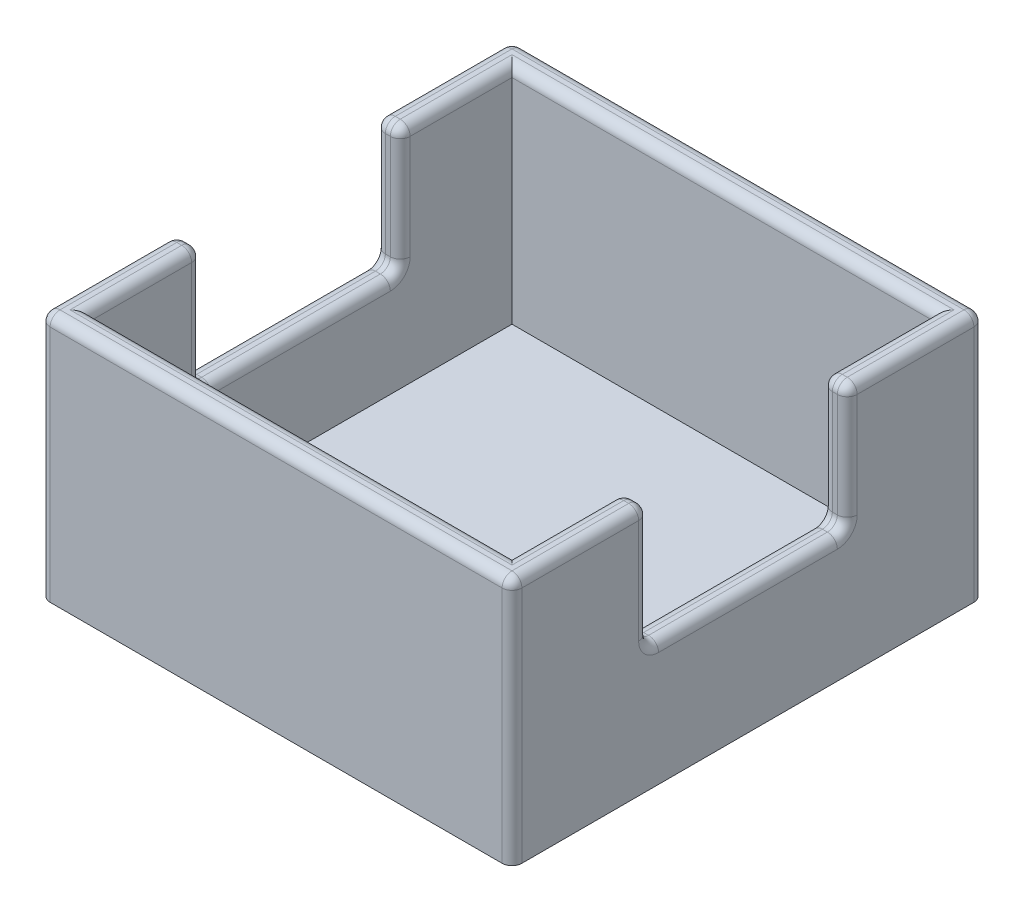
from build123d import *

# Parameters (mm, degrees)
SKETCH5_W           = 95
SKETCH5_H           = 95
BOSS_EXTRUDE3_DEPTH = 50
SHELL1_T            = -5
SKETCH6_W           = 40
SKETCH6_H           = 50
CUT_EXTRUDE2_DEPTH  = 100
FILLET2_R           = 2


with BuildPart() as part:
    # Sketch5 → Boss-Extrude3 (new body)
    with BuildSketch(Plane(origin=(0, 0, 0), x_dir=(1, 0, 0), z_dir=(0, 1, 0))):
        Rectangle(SKETCH5_W, SKETCH5_H)
    extrude(amount=BOSS_EXTRUDE3_DEPTH)

    # Shell1
    shell1_openings = [part.faces().sort_by_distance(p)[0] for p in [
        (0, 50, 0),
    ]]
    offset(amount=SHELL1_T, openings=shell1_openings, kind=Kind.INTERSECTION)

    # Sketch6 → Cut-Extrude2 (cut)
    with BuildSketch(Plane(origin=(47.5, 0, 0), x_dir=(0, 0, -1), z_dir=(1, 0, 0))):
        with Locations((0, 50)):
            Rectangle(SKETCH6_W, SKETCH6_H)
    extrude(amount=-CUT_EXTRUDE2_DEPTH, mode=Mode.SUBTRACT)

    # Fillet2
    fillet2_edges = [part.edges().sort_by_distance(p)[0] for p in [
        (42.5, 37.5, -20),
        (47.5, 37.5, -20),
        (47.5, 37.5, 20),
        (42.5, 37.5, 20),
        (-47.5, 37.5, 20),
        (-47.5, 37.5, -20),
        (-42.5, 37.5, -20),
        (-42.5, 37.5, 20),
        (45, 25, -20),
        (47.5, 25, 0),
        (45, 25, 20),
        (42.5, 25, 0),
        (-47.5, 25, 0),
        (-45, 25, -20),
        (-42.5, 25, 0),
        (-45, 25, 20),
        (0, 50, 47.5),
        (-47.5, 50, 33.75),
        (-45, 50, 20),
        (-42.5, 50, 31.25),
        (0, 50, 42.5),
        (42.5, 50, 31.25),
        (45, 50, 20),
        (47.5, 50, 33.75),
        (0, 50, -47.5),
        (47.5, 50, -33.75),
        (45, 50, -20),
        (42.5, 50, -31.25),
        (0, 50, -42.5),
        (-42.5, 50, -31.25),
        (-45, 50, -20),
        (-47.5, 50, -33.75),
        (47.5, 25, -47.5),
        (-47.5, 25, -47.5),
        (47.5, 25, 47.5),
        (-47.5, 25, 47.5),
    ]]
    fillet(fillet2_edges, radius=FILLET2_R)


solid = part.part
